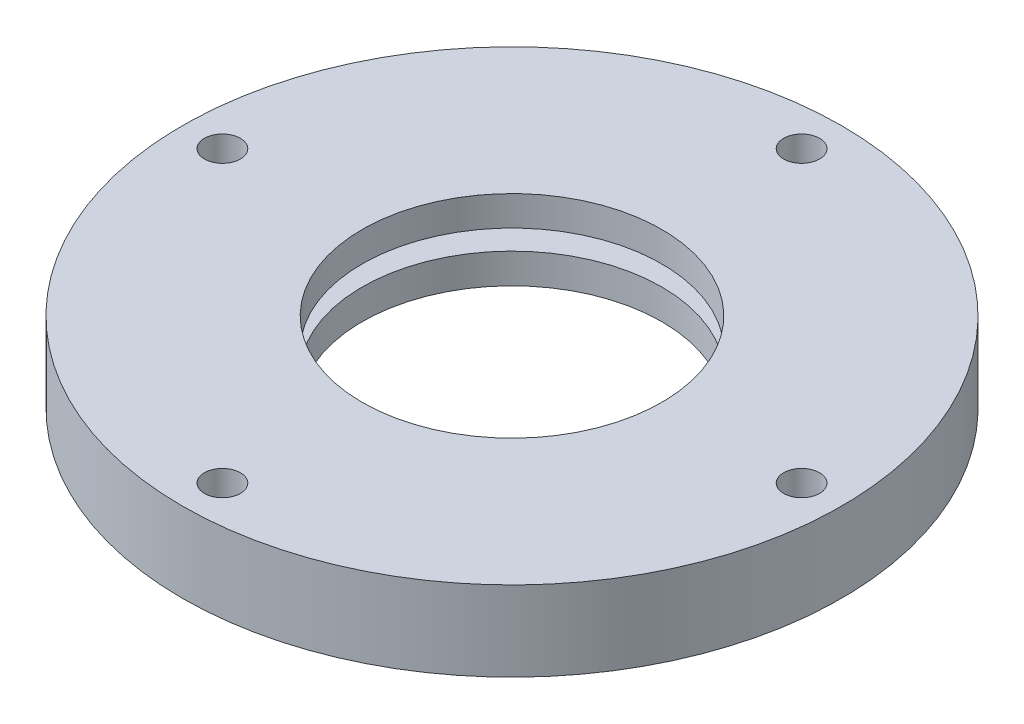
from build123d import *

# Parameters (mm, degrees)
SKETCH1_R                                       = 33
SKETCH1_R_2                                     = 1.5
BOSS_EXTRUDE1_DEPTH                             = 8
CSK_FOR_M3_FLAT_HEAD_MACHINE_SCREW1_D           = 3.6
CSK_FOR_M3_FLAT_HEAD_MACHINE_SCREW1_CSINK_D     = 6.3
CSK_FOR_M3_FLAT_HEAD_MACHINE_SCREW1_CSINK_ANGLE = 90
CORTAR_EXTRUIR1_REACH                           = 49.35
CROQUIS1_R                                      = 15
CROQUIS2_W                                      = 40
CROQUIS2_H                                      = 2
CORTAR_EXTRUIR2_DEPTH                           = 50


with BuildPart() as part:
    # Sketch1 → Boss-Extrude1 (new body)
    with BuildSketch(Plane(origin=(0, 0, 0), x_dir=(1, 0, 0), z_dir=(0, 1, 0))):
        Circle(SKETCH1_R)
        with Locations((-29, 0)):
            Circle(SKETCH1_R_2, mode=Mode.SUBTRACT)
        with Locations((0, 29)):
            Circle(SKETCH1_R_2, mode=Mode.SUBTRACT)
        with Locations((29, 0)):
            Circle(SKETCH1_R_2, mode=Mode.SUBTRACT)
        with Locations((0, -29)):
            Circle(SKETCH1_R_2, mode=Mode.SUBTRACT)
    extrude(amount=BOSS_EXTRUDE1_DEPTH)

    # CSK for M3 Flat Head Machine Screw1 (through all)
    with Locations(Plane(origin=(0, 0, 0), x_dir=(-1, 0, 0), z_dir=(0, -1, 0))):
        with Locations((0, -29), (29, 0), (0, 29), (-29, 0)):
            CounterSinkHole(CSK_FOR_M3_FLAT_HEAD_MACHINE_SCREW1_D / 2, CSK_FOR_M3_FLAT_HEAD_MACHINE_SCREW1_CSINK_D / 2, counter_sink_angle=CSK_FOR_M3_FLAT_HEAD_MACHINE_SCREW1_CSINK_ANGLE)

    # Croquis1 → Cortar-Extruir1 (cut, up to next)
    with BuildSketch(Plane.XZ, mode=Mode.PRIVATE) as cortar_extruir1_sk1:
        Circle(CROQUIS1_R)
    cortar_extruir1_tool1 = extrude(cortar_extruir1_sk1.sketch, amount=-CORTAR_EXTRUIR1_REACH, mode=Mode.PRIVATE) & part.part
    add(cortar_extruir1_tool1.solids().sort_by_distance((0, 0, 0))[0], mode=Mode.SUBTRACT)

    # Croquis2 → Cortar-Extruir2 (cut)
    with BuildSketch(Plane.ZY.offset(33)):
        with Locations((0, 4.010935524)):
            Rectangle(CROQUIS2_W, CROQUIS2_H)
    extrude(amount=-CORTAR_EXTRUIR2_DEPTH, mode=Mode.SUBTRACT)


solid = part.part
